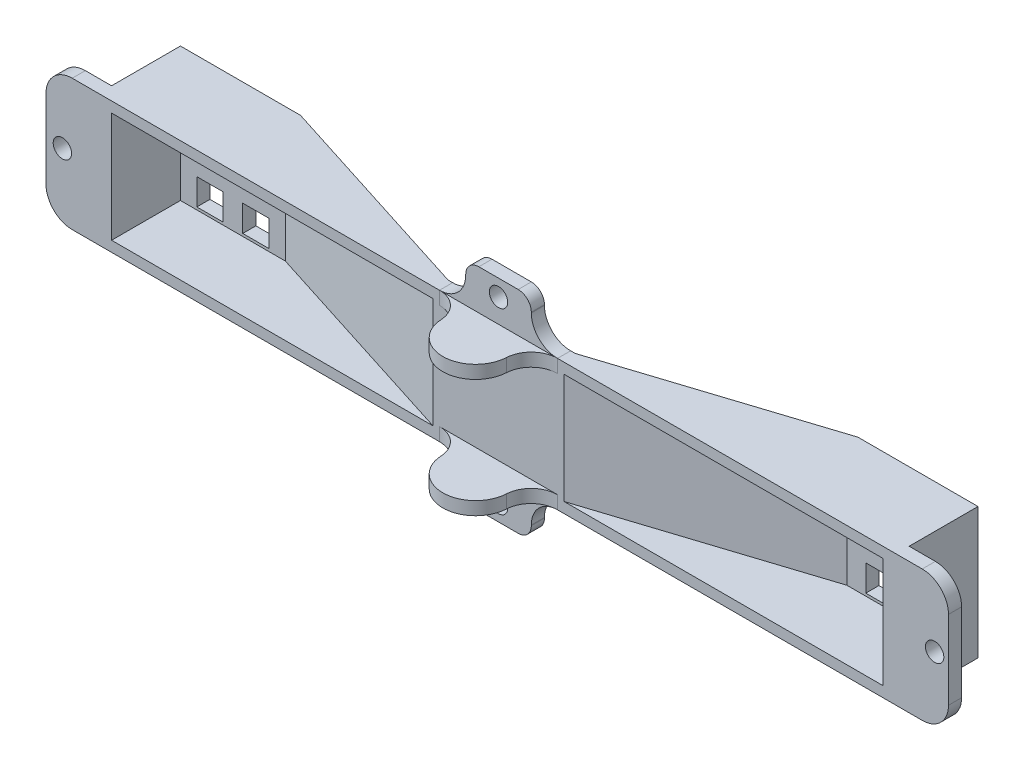
from build123d import *

# Parameters (mm, degrees)
ESTRUSIONE_ESTRUSIONE1_DEPTH = 20
SCHIZZO2_W                   = 4
SCHIZZO2_H                   = 4
TAGLIO_ESTRUSIONE2_DEPTH     = 20
SCHIZZO3_W                   = 10
SCHIZZO3_H                   = 6.102364877
ESTRUSIONE_ESTRUSIONE3_DEPTH = 2
ESTRUSIONE_ESTRUSIONE4_DEPTH = 1.6
ESTRUSIONE_ESTRUSIONE5_DEPTH = 1.6
SCHIZZO15_W                  = 10
SCHIZZO15_H                  = 2
ESTRUSIONE_ESTRUSIONE6_DEPTH = 8.5
ESTRUSIONE_ESTRUSIONE7_DEPTH = 1.6
ESTRUSIONE_ESTRUSIONE8_DEPTH = 1.6
SCHIZZO24_W                  = 10
SCHIZZO24_H                  = 2
ESTRUSIONE_ESTRUSIONE9_DEPTH = 8.5
RACCORDO1_RADIUS             = 5
RACCORDO1_LENGTH             = 2
RACCORDO2_RADIUS             = 5
RACCORDO2_LENGTH             = 2
RACCORDO3_R                  = 4
RACCORDO4_R                  = 4
RACCORDO6_R                  = 2
SCHIZZO28_R                  = 1.4
TAGLIO_ESTRUSIONE5_DEPTH     = 10
SCHIZZO29_R                  = 1.4
TAGLIO_ESTRUSIONE6_DEPTH     = 10


with BuildPart() as part:
    # Schizzo1 → Estrusione-Estrusione1 (new body)
    with BuildSketch(Plane(origin=(0, 0, 0), x_dir=(1, 0, 0), z_dir=(0, 1, 0))):
        Polygon((-16, 0), (0, 0), (33, -10.5), (53, -10.5), (85.612492158, 0), (101.612492158, 0), (101.612492158, -10.5), (111.612492158, -10.5), (111.612492158, -8.5), (103.612492158, -8.5), (103.612492158, 2), (85.29846697, 2), (52.685974812, -8.5), (33.310512217, -8.5), (0.310512217, 2), (-18, 2), (-18, -8.5), (-26, -8.5), (-26, -10.5), (-16, -10.5), align=None)
    extrude(amount=ESTRUSIONE_ESTRUSIONE1_DEPTH)

    # Schizzo2 → Taglio-Estrusione2 (cut)
    with BuildSketch(Plane.XY):
        with Locations((-11.5, 16)):
            Rectangle(SCHIZZO2_W, SCHIZZO2_H)
        with Locations((-4.5, 16)):
            Rectangle(SCHIZZO2_W, SCHIZZO2_H)
        with Locations((-4.5, 10)):
            Rectangle(SCHIZZO2_W, SCHIZZO2_H)
        with Locations((-4.5, 4)):
            Rectangle(SCHIZZO2_W, SCHIZZO2_H)
        with Locations((-11.5, 10)):
            Rectangle(SCHIZZO2_W, SCHIZZO2_H)
        with Locations((-11.5, 4)):
            Rectangle(SCHIZZO2_W, SCHIZZO2_H)
        with Locations((97.5, 4)):
            Rectangle(SCHIZZO2_W, SCHIZZO2_H)
        with Locations((90.5, 4)):
            Rectangle(SCHIZZO2_W, SCHIZZO2_H)
        with Locations((90.5, 10)):
            Rectangle(SCHIZZO2_W, SCHIZZO2_H)
        with Locations((97.5, 10)):
            Rectangle(SCHIZZO2_W, SCHIZZO2_H)
        with Locations((90.5, 16)):
            Rectangle(SCHIZZO2_W, SCHIZZO2_H)
        with Locations((97.5, 16)):
            Rectangle(SCHIZZO2_W, SCHIZZO2_H)
    extrude(amount=-TAGLIO_ESTRUSIONE2_DEPTH, mode=Mode.SUBTRACT)

    # Schizzo3 → Estrusione-Estrusione3 (add)
    with BuildSketch(Plane.XY.offset(10.5)):
        with Locations((43, 23.051182438)):
            Rectangle(SCHIZZO3_W, SCHIZZO3_H)
        with Locations((43, -3.051182439)):
            Rectangle(SCHIZZO3_W, SCHIZZO3_H)
    extrude(amount=-ESTRUSIONE_ESTRUSIONE3_DEPTH)

    # Schizzo4 → Estrusione-Estrusione4 (add)
    with BuildSketch(Plane.XZ):
        Polygon((-16, 0), (-16, 10.5), (33, 10.5), (0, 0), align=None)
    extrude(amount=-ESTRUSIONE_ESTRUSIONE4_DEPTH)

    # Schizzo6 → Estrusione-Estrusione5 (add)
    with BuildSketch(Plane.XZ):
        Polygon((101.612492158, 10.5), (53, 10.5), (85.612492158, 0), (101.612492158, 0), align=None)
    extrude(amount=-ESTRUSIONE_ESTRUSIONE5_DEPTH)

    # Schizzo15 → Estrusione-Estrusione6 (add)
    with BuildSketch(Plane.XY.offset(10.5)):
        with Locations((43, 1)):
            Rectangle(SCHIZZO15_W, SCHIZZO15_H)
    extrude(amount=ESTRUSIONE_ESTRUSIONE6_DEPTH)

    # Schizzo20 → Estrusione-Estrusione7 (add)
    with BuildSketch(Plane(origin=(0, 20, 0), x_dir=(1, 0, 0), z_dir=(0, 1, 0))):
        Polygon((101.612492158, -10.5), (53, -10.5), (85.612492158, 0), (101.612492158, 0), align=None)
    extrude(amount=-ESTRUSIONE_ESTRUSIONE7_DEPTH)

    # Schizzo23 → Estrusione-Estrusione8 (add)
    with BuildSketch(Plane(origin=(0, 20, 0), x_dir=(1, 0, 0), z_dir=(0, 1, 0))):
        Polygon((-16, -10.5), (33, -10.5), (0, 0), (-16, 0), align=None)
    extrude(amount=-ESTRUSIONE_ESTRUSIONE8_DEPTH)

    # Schizzo24 → Estrusione-Estrusione9 (add)
    with BuildSketch(Plane.XY.offset(10.5)):
        with Locations((43, 19)):
            Rectangle(SCHIZZO24_W, SCHIZZO24_H)
    extrude(amount=ESTRUSIONE_ESTRUSIONE9_DEPTH)

    # Raccordo1: full round fillet: the end face becomes a half cylinder, R = half its width
    raccordo1_face = Plane((43, 19, 19), x_dir=(0, -1, 0), z_dir=(0, 0, 1))  # on the end face: x along it, z out of the body
    raccordo1_slab = raccordo1_face.offset(-RACCORDO1_RADIUS / 2) * Box(RACCORDO1_LENGTH, 2 * RACCORDO1_RADIUS, RACCORDO1_RADIUS, mode=Mode.PRIVATE)  # the body's end, R deep
    raccordo1_round = Plane((43, 19, 14), x_dir=(0, 0, 1), z_dir=(0, -1, 0)) * Cylinder(RACCORDO1_RADIUS, RACCORDO1_LENGTH, mode=Mode.PRIVATE)  # its axis R under the face
    add(raccordo1_slab - raccordo1_round, mode=Mode.SUBTRACT)

    # Raccordo2: full round fillet: the end face becomes a half cylinder, R = half its width
    raccordo2_face = Plane((43, 1, 19), x_dir=(0, 1, 0), z_dir=(0, 0, 1))  # on the end face: x along it, z out of the body
    raccordo2_slab = raccordo2_face.offset(-RACCORDO2_RADIUS / 2) * Box(RACCORDO2_LENGTH, 2 * RACCORDO2_RADIUS, RACCORDO2_RADIUS, mode=Mode.PRIVATE)  # the body's end, R deep
    raccordo2_round = Plane((43, 1, 14), x_dir=(0, 0, 1), z_dir=(0, 1, 0)) * Cylinder(RACCORDO2_RADIUS, RACCORDO2_LENGTH, mode=Mode.PRIVATE)  # its axis R under the face
    add(raccordo2_slab - raccordo2_round, mode=Mode.SUBTRACT)

    # Raccordo3
    # the kernel refuses this fillet: 4 mm, written as the material it adds along each edge
    with BuildSketch(Plane(origin=(48, 2, 10.5), x_dir=(1, 0, 0), z_dir=(0, -1, 0)), Plane(origin=(38, 0, 10.5), x_dir=(-1, 0, 0), z_dir=(0, 1, 0)), Plane(origin=(38, 18, 10.5), x_dir=(-1, 0, 0), z_dir=(0, 1, 0)), Plane(origin=(48, 20, 10.5), x_dir=(1, 0, 0), z_dir=(0, -1, 0))) as raccordo3_piece_1:
        with BuildLine():
            CenterArc((3.986100378, 4), RACCORDO3_R, 183.184738537, 86.815261463)
            Line((-0.007722012, 3.777777778), (-0.407104251, 3.755555556))
            ThreePointArc((-0.407104251, 3.755555556), (-0.4, 3.5), (-0.4, 0))
            Line((-0.4, 0), (0, -0.4))
            Line((0, -0.4), (3.986100378, -0.4))
            Line((3.986100378, -0.4), (3.986100378, 0))
        make_face()
    extrude(amount=2)
    # the kernel refuses this fillet: 4 mm, written as the material it takes off along each edge
    with BuildSketch(Plane(origin=(-26, 0, -1.5), x_dir=(0, 1, 0), z_dir=(0, 0, 1)), Plane(origin=(111.612492158, 0, 20.5), x_dir=(0, 1, 0), z_dir=(0, 0, -1))) as raccordo3_2_piece_1:
        with BuildLine():
            CenterArc((RACCORDO3_R, -RACCORDO3_R), RACCORDO3_R, 90, 90)
            Line((0, -RACCORDO3_R), (0, 0))
            Line((0, 0), (RACCORDO3_R, 0))
        make_face()
    extrude(amount=22, mode=Mode.SUBTRACT)
    with BuildSketch(Plane(origin=(111.612492158, 20, 20.5), x_dir=(0, -1, 0), z_dir=(0, 0, -1)), Plane(origin=(-26, 20, -1.5), x_dir=(0, -1, 0), z_dir=(0, 0, 1))) as raccordo3_2_piece_2:
        with BuildLine():
            CenterArc((RACCORDO3_R, RACCORDO3_R), RACCORDO3_R, 180, 90)
            Line((0, RACCORDO3_R), (0, 0))
            Line((0, 0), (RACCORDO3_R, 0))
        make_face()
    extrude(amount=22, mode=Mode.SUBTRACT)

    # Raccordo4
    # the kernel refuses this fillet: 4 mm, written as the material it adds along each edge
    with BuildSketch(Plane(origin=(48, 20, 8.5), x_dir=(1, 0, 0), z_dir=(0, 0, 1)), Plane(origin=(38, 20, 10.5), x_dir=(-1, 0, 0), z_dir=(0, 0, -1)), Plane(origin=(38, 0, 8.5), x_dir=(-1, 0, 0), z_dir=(0, 0, 1)), Plane(origin=(48, 0, 10.5), x_dir=(1, 0, 0), z_dir=(0, 0, -1))) as raccordo4_piece_1:
        with BuildLine():
            CenterArc((RACCORDO4_R, RACCORDO4_R), RACCORDO4_R, 180, 90)
            Line((0, RACCORDO4_R), (0, 0))
            Line((0, 0), (RACCORDO4_R, 0))
        make_face()
    extrude(amount=2)

    # Raccordo6
    raccordo6_edges = [part.edges().sort_by_distance(p)[0] for p in [
        (38, 26.102364877, 9.5),
        (48, 26.102364877, 9.5),
        (48, -6.102364877, 9.5),
        (38, -6.102364877, 9.5),
    ]]
    fillet(raccordo6_edges, radius=RACCORDO6_R)

    # Schizzo28 → Taglio-Estrusione5 (cut)
    with BuildSketch(Plane(origin=(42.230610684, 213.6, 10.5), x_dir=(1, 0, 0), z_dir=(0, 0, 1))):
        with Locations((0.769389316, -189.997635123)):
            Circle(SCHIZZO28_R)
        with Locations((0.769389316, -217.202364877)):
            Circle(SCHIZZO28_R)
    extrude(amount=-TAGLIO_ESTRUSIONE5_DEPTH, mode=Mode.SUBTRACT)

    # Schizzo29 → Taglio-Estrusione6 (cut)
    with BuildSketch(Plane(origin=(42.230610684, 213.6, 10.5), x_dir=(1, 0, 0), z_dir=(0, 0, 1))):
        with Locations((-65.730610684, -203.6)):
            Circle(SCHIZZO29_R)
        with Locations((67.269389316, -203.6)):
            Circle(SCHIZZO29_R)
    extrude(amount=-TAGLIO_ESTRUSIONE6_DEPTH, mode=Mode.SUBTRACT)


solid = part.part
